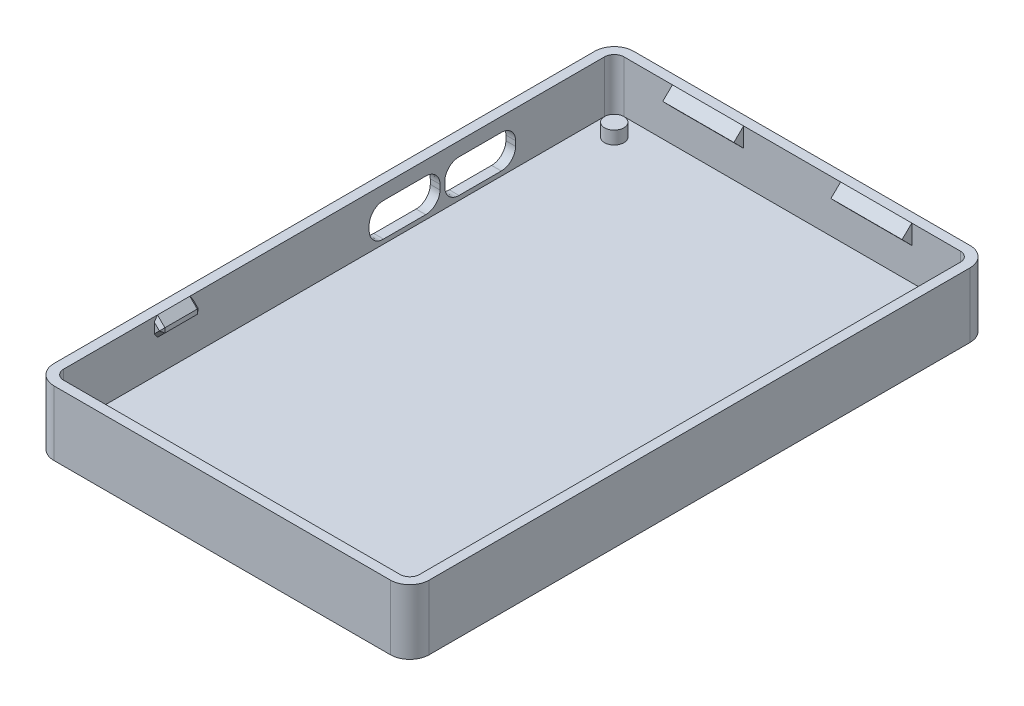
from build123d import *

# Parameters (mm, degrees)
EXTRUDE_1_DEPTH     = 2
EXTRUDE_2_DEPTH     = 11
SKETCH_5_R          = 1.5
EXTRUDE_3_DEPTH     = 2
CUT_EXTRUDE_1_DEPTH = 2
CUT_EXTRUDE_START   = -3
CUT_EXTRUDE_2_DEPTH = 3
SKETCH_8_W          = 11
SKETCH_8_H          = 3
EXTRUDE_4_DEPTH     = 1.5
CUT_EXTRUDE_3_DEPTH = 40
SKETCH_11_W         = 6
SKETCH_11_H         = 3
EXTRUDE_5_DEPTH     = 1.5
CUT_EXTRUDE_4_DEPTH = 7
SKETCH_13_W         = 6
SKETCH_13_H         = 3
EXTRUDE_6_DEPTH     = 1.5
CUT_EXTRUDE_5_DEPTH = 7
CHAMFER_1_SIZE      = 0.5
CHAMFER_2_SIZE      = 0.5


with BuildPart() as part:
    # 草图1 → 凸台-拉伸1 (new body)
    with BuildSketch(Plane(origin=(0, 0, 0), x_dir=(1, 0, 0), z_dir=(0, 1, 0))):
        with BuildLine():
            Line((3, 0), (55, 0))
            ThreePointArc((55, 0), (57.121320344, 0.878679656), (58, 3))
            Line((58, 3), (58, 86.6))
            ThreePointArc((58, 86.6), (57.121320344, 88.721320344), (55, 89.6))
            Line((55, 89.6), (3, 89.6))
            ThreePointArc((3, 89.6), (0.878679656, 88.721320344), (0, 86.6))
            Line((0, 86.6), (0, 3))
            ThreePointArc((0, 3), (0.878679656, 0.878679656), (3, 0))
        make_face()
    extrude(amount=EXTRUDE_1_DEPTH)

    # 草图3 → 凸台-拉伸2 (add)
    with BuildSketch(Plane(origin=(0, 2, 0), x_dir=(1, 0, 0), z_dir=(0, 1, 0))):
        with BuildLine():
            Line((0, 86.6), (0, 3))
            ThreePointArc((0, 3), (0.878679656, 0.878679656), (3, 0))
            Line((3, 0), (55, 0))
            ThreePointArc((55, 0), (57.121320344, 0.878679656), (58, 3))
            Line((58, 3), (58, 86.6))
            ThreePointArc((58, 86.6), (57.121320344, 88.721320344), (55, 89.6))
            Line((55, 89.6), (3, 89.6))
            ThreePointArc((3, 89.6), (0.878679656, 88.721320344), (0, 86.6))
        make_face()
        with BuildLine():
            Line((1.5, 86.6), (1.5, 3))
            ThreePointArc((1.5, 3), (1.939339828, 1.939339828), (3, 1.5))
            Line((3, 1.5), (55, 1.5))
            ThreePointArc((55, 1.5), (56.060660172, 1.939339828), (56.5, 3))
            Line((56.5, 3), (56.5, 86.6))
            ThreePointArc((56.5, 86.6), (56.060660172, 87.660660172), (55, 88.1))
            Line((55, 88.1), (3, 88.1))
            ThreePointArc((3, 88.1), (1.939339828, 87.660660172), (1.5, 86.6))
        make_face(mode=Mode.SUBTRACT)
    extrude(amount=EXTRUDE_2_DEPTH)

    # 草图5 → 凸台-拉伸3 (add)
    with BuildSketch(Plane(origin=(0, 2, 0), x_dir=(1, 0, 0), z_dir=(0, 1, 0))):
        with Locations(Location((5, 84.6, 0), (0, 0, 270))):
            Circle(SKETCH_5_R)
        with Locations(Location((53, 84.6, 0), (0, 0, 90))):
            Circle(SKETCH_5_R)
        with Locations(Location((53, 5, 0), (0, 0, 270))):
            Circle(SKETCH_5_R)
        with Locations(Location((5, 5, 0), (0, 0, 90))):
            Circle(SKETCH_5_R)
    extrude(amount=EXTRUDE_3_DEPTH)

    # 草图6 → 切除-拉伸1 (cut)
    # profile 1 of 4: a face of its own
    with BuildSketch(Plane(origin=(0, 2, -82.999537719), x_dir=(0, 1, 0), z_dir=(-1, 0, 0))):
        with BuildLine():
            add(Edge.make_bspline(
                [(3.650025513, -10.151031112), (3.92482832, -10.151031112), (4.462198601, -10.245555275), (5.25406566, -10.746990965), (5.755501349, -11.538858023), (5.850025513, -12.076228304), (5.850025513, -12.351031112)],
                knots=[0, 0, 0, 0, 0.25, 0.5, 0.75, 1, 1, 1, 1], degree=3))
            Line((5.850025513, -12.351031112), (5.850025513, -18.891031112))
            add(Edge.make_bspline(
                [(5.850025513, -18.891031112), (5.850025513, -19.165833919), (5.755501349, -19.7032042), (5.25406566, -20.495071258), (4.462198601, -20.996506948), (3.92482832, -21.091031112), (3.650025513, -21.091031112)],
                knots=[0, 0, 0, 0, 0.25, 0.5, 0.75, 1, 1, 1, 1], degree=3))
            Line((3.650025513, -21.091031112), (2.890025513, -21.091031112))
            add(Edge.make_bspline(
                [(2.890025513, -21.091031112), (2.615222706, -21.091031112), (2.077852425, -20.996506948), (1.285985366, -20.495071258), (0.784549677, -19.7032042), (0.690025513, -19.165833919), (0.690025513, -18.891031112)],
                knots=[0, 0, 0, 0, 0.25, 0.5, 0.75, 1, 1, 1, 1], degree=3))
            Line((0.690025513, -18.891031112), (0.690025513, -12.351031112))
            add(Edge.make_bspline(
                [(0.690025513, -12.351031112), (0.690025513, -12.076228304), (0.784549677, -11.538858023), (1.285985366, -10.746990965), (2.077852425, -10.245555275), (2.615222706, -10.151031112), (2.890025513, -10.151031112)],
                knots=[0, 0, 0, 0, 0.25, 0.5, 0.75, 1, 1, 1, 1], degree=3))
            Line((2.890025513, -10.151031112), (3.650025513, -10.151031112))
        make_face()
        with BuildLine():
            Line((2.890025513, -11.151031112), (3.650025513, -11.151031112))
            add(Edge.make_bspline(
                [(3.650025513, -11.151031112), (4.352969238, -11.151031112), (4.850025513, -11.648087386), (4.850025513, -12.351031112)],
                knots=[0, 0, 0, 0, 1, 1, 1, 1], degree=3, weights=[1, 0.804737854, 0.804737854, 1]))
            Line((4.850025513, -12.351031112), (4.850025513, -18.891031112))
            add(Edge.make_bspline(
                [(4.850025513, -18.891031112), (4.850025513, -19.593974837), (4.352969238, -20.091031112), (3.650025513, -20.091031112)],
                knots=[0, 0, 0, 0, 1, 1, 1, 1], degree=3, weights=[1, 0.804737854, 0.804737854, 1]))
            Line((3.650025513, -20.091031112), (2.890025513, -20.091031112))
            add(Edge.make_bspline(
                [(2.890025513, -20.091031112), (2.187081788, -20.091031112), (1.690025513, -19.593974837), (1.690025513, -18.891031112)],
                knots=[0, 0, 0, 0, 1, 1, 1, 1], degree=3, weights=[1, 0.804737854, 0.804737854, 1]))
            Line((1.690025513, -18.891031112), (1.690025513, -12.351031112))
            add(Edge.make_bspline(
                [(1.690025513, -12.351031112), (1.690025513, -11.648087386), (2.187081788, -11.151031112), (2.890025513, -11.151031112)],
                knots=[0, 0, 0, 0, 1, 1, 1, 1], degree=3, weights=[1, 0.804737854, 0.804737854, 1]))
        make_face(mode=Mode.SUBTRACT)
    # profile 2 of 4: a face of its own
    with BuildSketch(Plane(origin=(0, 2, -82.999537719), x_dir=(0, 1, 0), z_dir=(-1, 0, 0))):
        with BuildLine():
            add(Edge.make_bspline(
                [(3.650025513, -11.151031112), (4.352969238, -11.151031112), (4.850025513, -11.648087386), (4.850025513, -12.351031112)],
                knots=[0, 0, 0, 0, 1, 1, 1, 1], degree=3, weights=[1, 0.804737854, 0.804737854, 1]))
            Line((4.850025513, -12.351031112), (4.850025513, -18.891031112))
            add(Edge.make_bspline(
                [(4.850025513, -18.891031112), (4.850025513, -19.593974837), (4.352969238, -20.091031112), (3.650025513, -20.091031112)],
                knots=[0, 0, 0, 0, 1, 1, 1, 1], degree=3, weights=[1, 0.804737854, 0.804737854, 1]))
            Line((3.650025513, -20.091031112), (2.890025513, -20.091031112))
            add(Edge.make_bspline(
                [(2.890025513, -20.091031112), (2.187081788, -20.091031112), (1.690025513, -19.593974837), (1.690025513, -18.891031112)],
                knots=[0, 0, 0, 0, 1, 1, 1, 1], degree=3, weights=[1, 0.804737854, 0.804737854, 1]))
            Line((1.690025513, -18.891031112), (1.690025513, -12.351031112))
            add(Edge.make_bspline(
                [(1.690025513, -12.351031112), (1.690025513, -11.648087386), (2.187081788, -11.151031112), (2.890025513, -11.151031112)],
                knots=[0, 0, 0, 0, 1, 1, 1, 1], degree=3, weights=[1, 0.804737854, 0.804737854, 1]))
            Line((2.890025513, -11.151031112), (3.650025513, -11.151031112))
        make_face()
    # profile 3 of 4: a face of its own
    with BuildSketch(Plane(origin=(0, 2, -82.999537719), x_dir=(0, 1, 0), z_dir=(-1, 0, 0))):
        with BuildLine():
            add(Edge.make_bspline(
                [(3.650025513, -21.83505448), (3.92482832, -21.83505448), (4.462198601, -21.929578643), (5.25406566, -22.431014333), (5.755501349, -23.222881391), (5.850025513, -23.760251672), (5.850025513, -24.03505448)],
                knots=[0, 0, 0, 0, 0.25, 0.5, 0.75, 1, 1, 1, 1], degree=3))
            Line((5.850025513, -24.03505448), (5.850025513, -30.57505448))
            add(Edge.make_bspline(
                [(5.850025513, -30.57505448), (5.850025513, -30.849857287), (5.755501349, -31.387227568), (5.25406566, -32.179094626), (4.462198601, -32.680530316), (3.92482832, -32.77505448), (3.650025513, -32.77505448)],
                knots=[0, 0, 0, 0, 0.25, 0.5, 0.75, 1, 1, 1, 1], degree=3))
            Line((3.650025513, -32.77505448), (2.890025513, -32.77505448))
            add(Edge.make_bspline(
                [(2.890025513, -32.77505448), (2.615222706, -32.77505448), (2.077852425, -32.680530316), (1.285985366, -32.179094626), (0.784549677, -31.387227568), (0.690025513, -30.849857287), (0.690025513, -30.57505448)],
                knots=[0, 0, 0, 0, 0.25, 0.5, 0.75, 1, 1, 1, 1], degree=3))
            Line((0.690025513, -30.57505448), (0.690025513, -24.03505448))
            add(Edge.make_bspline(
                [(0.690025513, -24.03505448), (0.690025513, -23.760251672), (0.784549677, -23.222881391), (1.285985366, -22.431014333), (2.077852425, -21.929578643), (2.615222706, -21.83505448), (2.890025513, -21.83505448)],
                knots=[0, 0, 0, 0, 0.25, 0.5, 0.75, 1, 1, 1, 1], degree=3))
            Line((2.890025513, -21.83505448), (3.650025513, -21.83505448))
        make_face()
        with BuildLine():
            Line((2.890025513, -22.83505448), (3.650025513, -22.83505448))
            add(Edge.make_bspline(
                [(3.650025513, -22.83505448), (4.352969238, -22.83505448), (4.850025513, -23.332110755), (4.850025513, -24.03505448)],
                knots=[0, 0, 0, 0, 1, 1, 1, 1], degree=3, weights=[1, 0.804737854, 0.804737854, 1]))
            Line((4.850025513, -24.03505448), (4.850025513, -30.57505448))
            add(Edge.make_bspline(
                [(4.850025513, -30.57505448), (4.850025513, -31.277998205), (4.352969238, -31.77505448), (3.650025513, -31.77505448)],
                knots=[0, 0, 0, 0, 1, 1, 1, 1], degree=3, weights=[1, 0.804737854, 0.804737854, 1]))
            Line((3.650025513, -31.77505448), (2.890025513, -31.77505448))
            add(Edge.make_bspline(
                [(2.890025513, -31.77505448), (2.187081788, -31.77505448), (1.690025513, -31.277998205), (1.690025513, -30.57505448)],
                knots=[0, 0, 0, 0, 1, 1, 1, 1], degree=3, weights=[1, 0.804737854, 0.804737854, 1]))
            Line((1.690025513, -30.57505448), (1.690025513, -24.03505448))
            add(Edge.make_bspline(
                [(1.690025513, -24.03505448), (1.690025513, -23.332110755), (2.187081788, -22.83505448), (2.890025513, -22.83505448)],
                knots=[0, 0, 0, 0, 1, 1, 1, 1], degree=3, weights=[1, 0.804737854, 0.804737854, 1]))
        make_face(mode=Mode.SUBTRACT)
    # profile 4 of 4: a face of its own
    with BuildSketch(Plane(origin=(0, 2, -82.999537719), x_dir=(0, 1, 0), z_dir=(-1, 0, 0))):
        with BuildLine():
            add(Edge.make_bspline(
                [(3.650025513, -22.83505448), (4.352969238, -22.83505448), (4.850025513, -23.332110755), (4.850025513, -24.03505448)],
                knots=[0, 0, 0, 0, 1, 1, 1, 1], degree=3, weights=[1, 0.804737854, 0.804737854, 1]))
            Line((4.850025513, -24.03505448), (4.850025513, -30.57505448))
            add(Edge.make_bspline(
                [(4.850025513, -30.57505448), (4.850025513, -31.277998205), (4.352969238, -31.77505448), (3.650025513, -31.77505448)],
                knots=[0, 0, 0, 0, 1, 1, 1, 1], degree=3, weights=[1, 0.804737854, 0.804737854, 1]))
            Line((3.650025513, -31.77505448), (2.890025513, -31.77505448))
            add(Edge.make_bspline(
                [(2.890025513, -31.77505448), (2.187081788, -31.77505448), (1.690025513, -31.277998205), (1.690025513, -30.57505448)],
                knots=[0, 0, 0, 0, 1, 1, 1, 1], degree=3, weights=[1, 0.804737854, 0.804737854, 1]))
            Line((1.690025513, -30.57505448), (1.690025513, -24.03505448))
            add(Edge.make_bspline(
                [(1.690025513, -24.03505448), (1.690025513, -23.332110755), (2.187081788, -22.83505448), (2.890025513, -22.83505448)],
                knots=[0, 0, 0, 0, 1, 1, 1, 1], degree=3, weights=[1, 0.804737854, 0.804737854, 1]))
            Line((2.890025513, -22.83505448), (3.650025513, -22.83505448))
        make_face()
    extrude(amount=-CUT_EXTRUDE_1_DEPTH, mode=Mode.SUBTRACT)

    # 草图7 → 切除-拉伸2 (cut)
    with BuildSketch(Plane(origin=(0, 13, 0), x_dir=(1, 0, 0), z_dir=(0, 1, 0)).offset(CUT_EXTRUDE_START)):
        with BuildLine():
            Line((0, 86.6), (0, 3))
            ThreePointArc((0, 3), (0.878679656, 0.878679656), (3, 0))
            Line((3, 0), (55, 0))
            ThreePointArc((55, 0), (57.121320344, 0.878679656), (58, 3))
            Line((58, 3), (58, 86.6))
            ThreePointArc((58, 86.6), (57.121320344, 88.721320344), (55, 89.6))
            Line((55, 89.6), (3, 89.6))
            ThreePointArc((3, 89.6), (0.878679656, 88.721320344), (0, 86.6))
        make_face()
        with BuildLine():
            Line((3, 1.5), (55, 1.5))
            ThreePointArc((55, 1.5), (56.060660172, 1.939339828), (56.5, 3))
            Line((56.5, 3), (56.5, 86.6))
            ThreePointArc((56.5, 86.6), (56.060660172, 87.660660172), (55, 88.1))
            Line((55, 88.1), (3, 88.1))
            ThreePointArc((3, 88.1), (1.939339828, 87.660660172), (1.5, 86.6))
            Line((1.5, 86.6), (1.5, 3))
            ThreePointArc((1.5, 3), (1.939339828, 1.939339828), (3, 1.5))
        make_face(mode=Mode.SUBTRACT)
    extrude(amount=CUT_EXTRUDE_2_DEPTH, mode=Mode.SUBTRACT)

    # 草图8 → 凸台-拉伸4 (add)
    with BuildSketch(Plane.XY.offset(-88.1)):
        with Locations((16, 8.5)):
            Rectangle(SKETCH_8_W, SKETCH_8_H)
        with Locations((42, 8.5)):
            Rectangle(SKETCH_8_W, SKETCH_8_H)
    extrude(amount=EXTRUDE_4_DEPTH)

    # 草图10 → 切除-拉伸3 (cut)
    with BuildSketch(Plane.ZY.offset(-10.5)):
        Polygon((-86.6, 10), (-88.1, 10), (-86.6, 8.534338043), align=None)
        Polygon((-86.6, 7), (-86.6, 8.534338043), (-88.1, 7), align=None)
    extrude(amount=-CUT_EXTRUDE_3_DEPTH, mode=Mode.SUBTRACT)

    # 草图11 → 凸台-拉伸5 (add)
    with BuildSketch(Plane(origin=(1.5, 0, 0), x_dir=(0, 0, -1), z_dir=(1, 0, 0))):
        with Locations((20, 8.5)):
            Rectangle(SKETCH_11_W, SKETCH_11_H)
    extrude(amount=EXTRUDE_5_DEPTH)

    # 草图12 → 切除-拉伸4 (cut)
    with BuildSketch(Plane.XY.offset(-17)):
        Polygon((1.5, 10), (3, 8.5), (3, 10), align=None)
        Polygon((3, 7), (3, 8.5), (1.5, 7), align=None)
    extrude(amount=-CUT_EXTRUDE_4_DEPTH, mode=Mode.SUBTRACT)

    # 草图13 → 凸台-拉伸6 (add)
    with BuildSketch(Plane.ZY.offset(-56.5)):
        with Locations((-20, 8.5)):
            Rectangle(SKETCH_13_W, SKETCH_13_H)
    extrude(amount=EXTRUDE_6_DEPTH)

    # 草图15 → 切除-拉伸5 (cut)
    with BuildSketch(Plane(origin=(0, 0, -23), x_dir=(-1, 0, 0), z_dir=(0, 0, -1))):
        Polygon((-55, 10), (-56.5, 10), (-55, 8.5), align=None)
        Polygon((-55, 7), (-55, 8.5), (-56.5, 7), align=None)
    extrude(amount=-CUT_EXTRUDE_5_DEPTH, mode=Mode.SUBTRACT)

    # 倒角1
    # the kernel refuses this chamfer: 0.5 mm, written as the material it takes off along each edge
    with BuildSketch(Plane(origin=(2.528595479, 8.5, -17.333333333), x_dir=(0.49999999999999983, 0.5000000000000011, -0.7071067811865469), z_dir=(0.8164965809277256, 1.025580099404569e-15, 0.5773502691896265))) as chamfer_1_piece_1:
        Polygon((-0.353553391, 0.204124145), (0.353553391, 0.204124145), (0, -0.40824829), align=None)
    extrude(amount=0.635085296, mode=Mode.SUBTRACT)
    with BuildSketch(Plane(origin=(2.528595479, 8.5, -22.666666667), x_dir=(0.49999999999999983, 0.5000000000000011, 0.7071067811865469), z_dir=(0.8164965809277256, 1.025580099404569e-15, -0.5773502691896265))) as chamfer_1_piece_2:
        Polygon((-0.353553391, -0.204124145), (0.353553391, -0.204124145), (0, 0.40824829), align=None)
    extrude(amount=0.635085296, mode=Mode.SUBTRACT)
    with BuildSketch(Plane(origin=(3, 8.5, -15.714158506), x_dir=(-0.6873969152646602, 0.726281956876687, 0), z_dir=(0, 0, -1))) as chamfer_1_piece_3:
        Polygon((CHAMFER_1_SIZE * 0.999621916911, -CHAMFER_1_SIZE * 0.0274958766106), (-CHAMFER_1_SIZE * 0.0274958766106, -CHAMFER_1_SIZE * 0.999621916911), (0, 0), align=None)
    extrude(amount=8.571682988, mode=Mode.SUBTRACT)
    with BuildSketch(Plane(origin=(3.90922724, 7.59077276, -23), x_dir=(0.019442520806015454, 0.01944252080601548, 0.9996219169112968), z_dir=(-0.707106781186548, 0.7071067811865471, 0))) as chamfer_1_piece_4_section:
        Polygon((CHAMFER_1_SIZE * 0.999621916911, -CHAMFER_1_SIZE * 0.0274958766106), (-CHAMFER_1_SIZE * 0.0274958766106, -CHAMFER_1_SIZE * 0.999621916911), (0, 0), align=None)
    chamfer_1_piece_4 = extrude(amount=4.693003332, mode=Mode.PRIVATE)
    chamfer_1_piece_4 = split(chamfer_1_piece_4, bisect_by=Plane(origin=(1.5, 9.080759878, -22.829780558), z_dir=(1, 0, 0)), keep=Keep.TOP, mode=Mode.PRIVATE)
    add(chamfer_1_piece_4, mode=Mode.SUBTRACT)
    with BuildSketch(Plane(origin=(0.59077276, 10.90922724, -17), x_dir=(-0.706839436070673, -0.7068394360706738, 0.027495876610589054), z_dir=(0.707106781186548, -0.7071067811865471, 0))) as chamfer_1_piece_5_section:
        Polygon((CHAMFER_1_SIZE * 0.999621916911, CHAMFER_1_SIZE * 0.0274958766106), (-CHAMFER_1_SIZE * 0.0274958766106, CHAMFER_1_SIZE * 0.999621916911), (0, 0), align=None)
    chamfer_1_piece_5 = extrude(amount=4.693003332, mode=Mode.PRIVATE)
    chamfer_1_piece_5 = split(chamfer_1_piece_5, bisect_by=Plane(origin=(1.5, 9.080759878, -17.170219442), z_dir=(1, 0, 0)), keep=Keep.TOP, mode=Mode.PRIVATE)
    add(chamfer_1_piece_5, mode=Mode.SUBTRACT)
    with BuildSketch(Plane(origin=(0.59077276, 6.09077276, -23), x_dir=(0.019442520806014385, -0.019442520806014392, 0.9996219169112968), z_dir=(0.7071067811865477, 0.7071067811865474, 0))) as chamfer_1_piece_6_section:
        Polygon((CHAMFER_1_SIZE * 0.999621916911, -CHAMFER_1_SIZE * 0.0274958766106), (-CHAMFER_1_SIZE * 0.0274958766106, -CHAMFER_1_SIZE * 0.999621916911), (0, 0), align=None)
    chamfer_1_piece_6 = extrude(amount=4.693003332, mode=Mode.PRIVATE)
    chamfer_1_piece_6 = split(chamfer_1_piece_6, bisect_by=Plane(origin=(1.5, 7.919240122, -22.829780558), z_dir=(1, 0, 0)), keep=Keep.TOP, mode=Mode.PRIVATE)
    add(chamfer_1_piece_6, mode=Mode.SUBTRACT)
    with BuildSketch(Plane(origin=(3.90922724, 9.40922724, -17), x_dir=(-0.7068394360706733, 0.7068394360706736, 0.027495876610589113), z_dir=(-0.7071067811865477, -0.7071067811865474, 0))) as chamfer_1_piece_7_section:
        Polygon((CHAMFER_1_SIZE * 0.999621916911, CHAMFER_1_SIZE * 0.0274958766106), (-CHAMFER_1_SIZE * 0.0274958766106, CHAMFER_1_SIZE * 0.999621916911), (0, 0), align=None)
    chamfer_1_piece_7 = extrude(amount=4.693003332, mode=Mode.PRIVATE)
    chamfer_1_piece_7 = split(chamfer_1_piece_7, bisect_by=Plane(origin=(1.5, 7.919240122, -17.170219442), z_dir=(1, 0, 0)), keep=Keep.TOP, mode=Mode.PRIVATE)
    add(chamfer_1_piece_7, mode=Mode.SUBTRACT)

    # 倒角2
    # the kernel refuses this chamfer: 0.5 mm, written as the material it takes off along each edge
    with BuildSketch(Plane(origin=(55.471404521, 8.5, -22.666666667), x_dir=(0, -1, 0), z_dir=(-0.8164965809277265, -8.20464079523654e-15, -0.577350269189625)), Plane(origin=(55.471404521, 8.5, -17.333333333), x_dir=(0.5000000000000033, -0.4999999999999983, 0.7071067811865465), z_dir=(-0.8164965809277265, -8.20464079523654e-15, 0.577350269189625))) as chamfer_2_piece_1:
        Polygon((-0.353553391, 0.204124145), (0.353553391, 0.204124145), (0, -0.40824829), align=None)
    extrude(amount=0.635085296, mode=Mode.SUBTRACT)
    with BuildSketch(Plane(origin=(55, 8.5, -24.285841494), x_dir=(0.687396915264656, 0.7262819568766907, 0), z_dir=(0, 0, 1))) as chamfer_2_piece_2:
        Polygon((CHAMFER_2_SIZE * 0.999621916911, -CHAMFER_2_SIZE * 0.0274958766106), (-CHAMFER_2_SIZE * 0.0274958766106, -CHAMFER_2_SIZE * 0.999621916911), (0, 0), align=None)
    extrude(amount=8.571682988, mode=Mode.SUBTRACT)
    with BuildSketch(Plane(origin=(57.40922724, 10.90922724, -17), x_dir=(-0.019442520806010305, 0.019442520806010277, -0.999621916911297), z_dir=(-0.7071067811865471, -0.707106781186548, 0))) as chamfer_2_piece_3_section:
        Polygon((CHAMFER_2_SIZE * 0.999621916911, CHAMFER_2_SIZE * 0.0274958766106), (-CHAMFER_2_SIZE * 0.0274958766106, CHAMFER_2_SIZE * 0.999621916911), (0, 0), align=None)
    chamfer_2_piece_3 = extrude(amount=4.693003332, mode=Mode.PRIVATE)
    chamfer_2_piece_3 = split(chamfer_2_piece_3, bisect_by=Plane(origin=(56.5, 9.080759878, -17.170219442), z_dir=(-1, 0, 0)), keep=Keep.TOP, mode=Mode.PRIVATE)
    add(chamfer_2_piece_3, mode=Mode.SUBTRACT)
    with BuildSketch(Plane(origin=(57.40922724, 10.90922724, -23), x_dir=(-0.019442520806013754, 0.019442520806013726, 0.9996219169112968), z_dir=(-0.7071067811865471, -0.707106781186548, 0))) as chamfer_2_piece_4_section:
        Polygon((CHAMFER_2_SIZE * 0.999621916911, -CHAMFER_2_SIZE * 0.0274958766106), (-CHAMFER_2_SIZE * 0.0274958766106, -CHAMFER_2_SIZE * 0.999621916911), (0, 0), align=None)
    chamfer_2_piece_4 = extrude(amount=4.693003332, mode=Mode.PRIVATE)
    chamfer_2_piece_4 = split(chamfer_2_piece_4, bisect_by=Plane(origin=(56.5, 9.080759878, -22.829780558), z_dir=(-1, 0, 0)), keep=Keep.TOP, mode=Mode.PRIVATE)
    add(chamfer_2_piece_4, mode=Mode.SUBTRACT)
    with BuildSketch(Plane(origin=(54.09077276, 9.40922724, -17), x_dir=(0.7068394360706738, 0.7068394360706729, 0.027495876610589075), z_dir=(0.7071067811865471, -0.707106781186548, 0))) as chamfer_2_piece_5_section:
        Polygon((CHAMFER_2_SIZE * 0.999621916911, -CHAMFER_2_SIZE * 0.0274958766106), (-CHAMFER_2_SIZE * 0.0274958766106, -CHAMFER_2_SIZE * 0.999621916911), (0, 0), align=None)
    chamfer_2_piece_5 = extrude(amount=4.693003332, mode=Mode.PRIVATE)
    chamfer_2_piece_5 = split(chamfer_2_piece_5, bisect_by=Plane(origin=(56.5, 7.919240122, -17.170219442), z_dir=(-1, 0, 0)), keep=Keep.TOP, mode=Mode.PRIVATE)
    add(chamfer_2_piece_5, mode=Mode.SUBTRACT)
    with BuildSketch(Plane(origin=(54.09077276, 9.40922724, -23), x_dir=(-0.01944252080601548, -0.019442520806015454, 0.9996219169112968), z_dir=(0.7071067811865471, -0.707106781186548, 0))) as chamfer_2_piece_6_section:
        Polygon((CHAMFER_2_SIZE * 0.999621916911, -CHAMFER_2_SIZE * 0.0274958766106), (-CHAMFER_2_SIZE * 0.0274958766106, -CHAMFER_2_SIZE * 0.999621916911), (0, 0), align=None)
    chamfer_2_piece_6 = extrude(amount=4.693003332, mode=Mode.PRIVATE)
    chamfer_2_piece_6 = split(chamfer_2_piece_6, bisect_by=Plane(origin=(56.5, 7.919240122, -22.829780558), z_dir=(-1, 0, 0)), keep=Keep.TOP, mode=Mode.PRIVATE)
    add(chamfer_2_piece_6, mode=Mode.SUBTRACT)


solid = part.part
